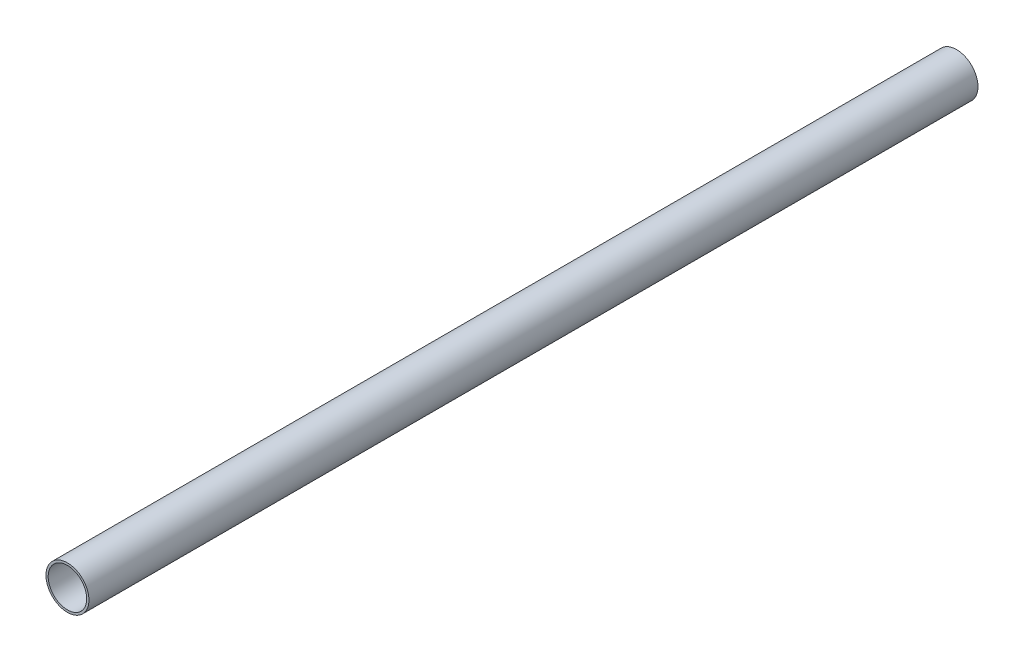
from build123d import *

# Parameters (mm, degrees)
SKETCH1_R           = 11.1125
SKETCH1_R_2         = 9.9695
BOSS_EXTRUDE1_DEPTH = 230


with BuildPart() as part:
    # Sketch1 → Boss-Extrude1 (new, symmetric)
    with BuildSketch(Plane.XY):
        Circle(SKETCH1_R)
        Circle(SKETCH1_R_2, mode=Mode.SUBTRACT)
    extrude(amount=BOSS_EXTRUDE1_DEPTH, both=True)


solid = part.part
